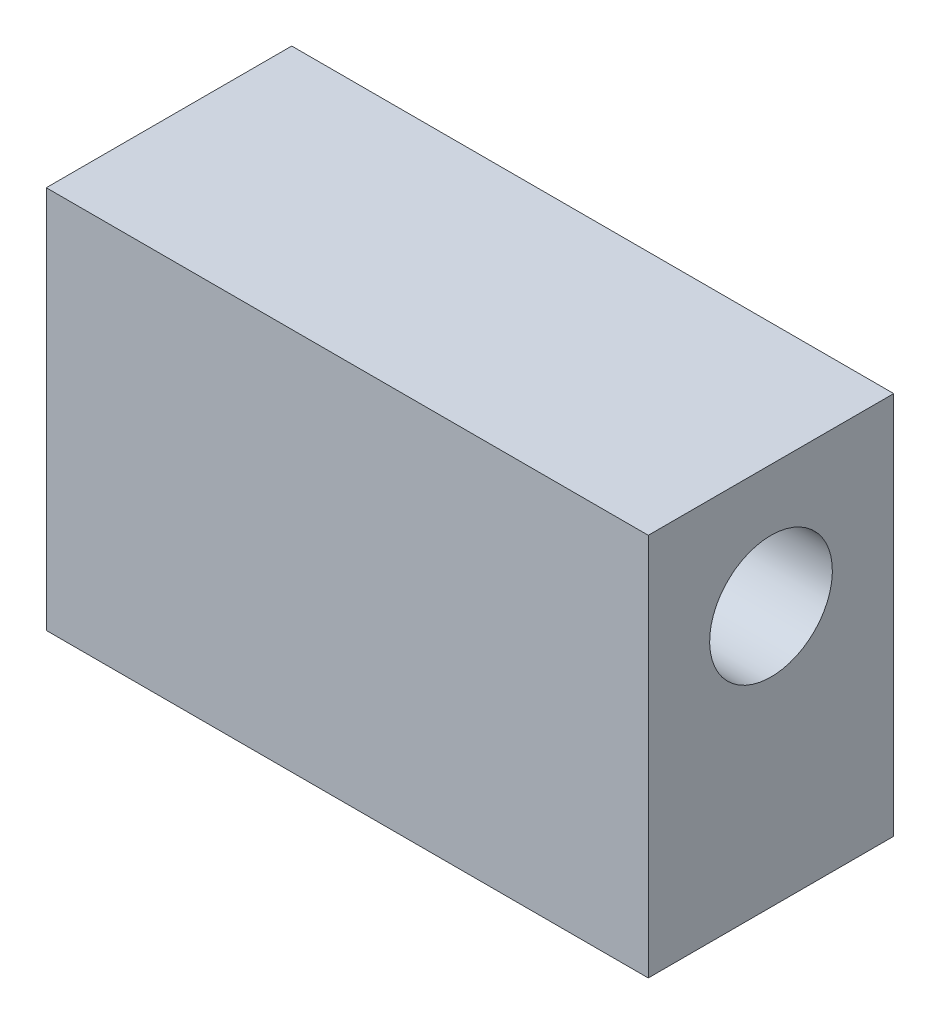
from build123d import *
from build123d.topology import SkipClean

# Parameters (mm, degrees)
SKETCH3_W                      = 31.148374891
SKETCH3_H                      = 19.837641971
BOSS_EXTRUDE1_DEPTH            = 6.35
SKETCH4_R                      = 3.175
CUT_EXTRUDE1_DEPTH             = 9.525
SKETCH5_R                      = 3.175
CUT_EXTRUDE5_DEPTH             = 9.525
CUT_EXTRUDE5_DIRECTION_2_REACH = 33.299
SKETCH6_R                      = 3.175
CUT_EXTRUDE6_DEPTH             = 9.525


with BuildPart() as part:
    # Sketch3 → Boss-Extrude1 (new, symmetric)
    with BuildSketch(Plane.XY):
        with Locations((15.574187446, -9.918820986)):
            Rectangle(SKETCH3_W, SKETCH3_H)
    extrude(amount=BOSS_EXTRUDE1_DEPTH, both=True)

    # Sketch4 → Cut-Extrude1 (cut)
    with BuildSketch(Plane.ZY):
        with Locations((0, -6.35)):
            Circle(SKETCH4_R)
    cut_extrude1 = extrude(amount=-CUT_EXTRUDE1_DEPTH, mode=Mode.SUBTRACT)

    # Sketch5 → Cut-Extrude5 (cut)
    with BuildSketch(Plane(origin=(7.787093723, -19.837641971, 0), x_dir=(-0.8660254037844382, 0.500000000000001, 0), z_dir=(-0.500000000000001, -0.8660254037844382, 0))):
        Circle(SKETCH5_R)
    cut_extrude5 = extrude(amount=-CUT_EXTRUDE5_DEPTH, mode=Mode.SUBTRACT)

    # Sketch5 → Cut-Extrude5 direction 2 (cut, up to next)
    with BuildSketch(Plane(origin=(7.787093723, -19.837641971, 0), x_dir=(-0.8660254037844382, 0.500000000000001, 0), z_dir=(-0.500000000000001, -0.8660254037844382, 0)), mode=Mode.PRIVATE) as cut_extrude5_direction_2_sk1:
        Circle(SKETCH5_R)
    cut_extrude5_direction_2_tool1 = extrude(cut_extrude5_direction_2_sk1.sketch, amount=CUT_EXTRUDE5_DIRECTION_2_REACH, mode=Mode.PRIVATE) & part.part
    cut_extrude5_direction_2 = cut_extrude5_direction_2_tool1.solids().sort_by_distance((7.787094, -19.837642, 0))[0]
    add(cut_extrude5_direction_2, mode=Mode.SUBTRACT)

    # Mirror1: Cut-Extrude1, Cut-Extrude5, Cut-Extrude5 direction 2 across plane
    with SkipClean():  # the faces are left unmerged after this step: merging them gives an invalid solid
        add(cut_extrude1.mirror(Plane.ZY.offset(-15.574187445)), mode=Mode.SUBTRACT)
        add(cut_extrude5.mirror(Plane.ZY.offset(-15.574187445)), mode=Mode.SUBTRACT)
        add(cut_extrude5_direction_2.mirror(Plane.ZY.offset(-15.574187445)), mode=Mode.SUBTRACT)

    # Sketch6 → Cut-Extrude6 (cut)
    with SkipClean():  # the faces are left unmerged after this step: merging them gives an invalid solid
        with BuildSketch(Plane(origin=(0, 0, -6.35), x_dir=(-1, 0, 0), z_dir=(0, 0, -1))):
            with Locations((-15.574187445, -6.35)):
                Circle(SKETCH6_R)
        extrude(amount=-CUT_EXTRUDE6_DEPTH, mode=Mode.SUBTRACT)


solid = part.part
